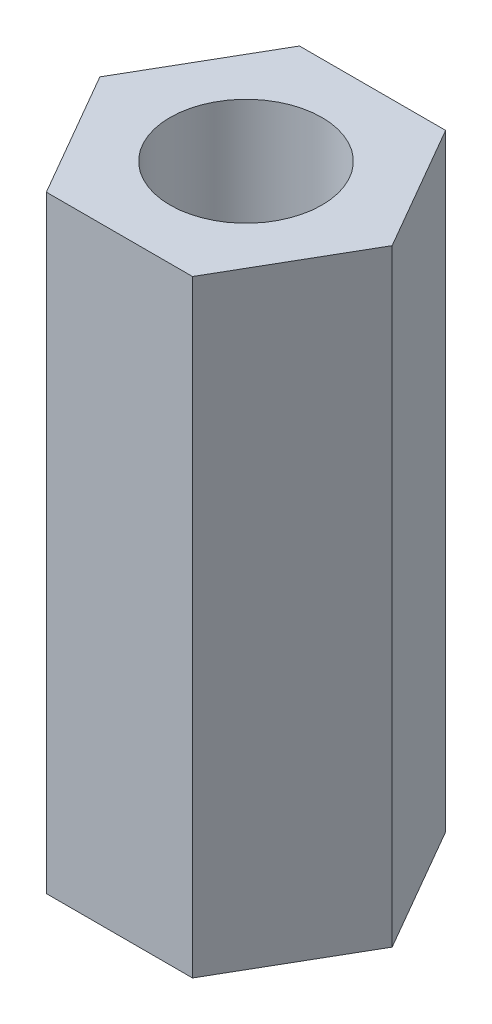
from build123d import *

# Parameters (mm, degrees)
CROQUIS1_R              = 1.5
SALIENTE_EXTRUIR1_DEPTH = 6


with BuildPart() as part:
    # Croquis1 → Saliente-Extruir1 (new, symmetric)
    with BuildSketch(Plane(origin=(0, 0, 0), x_dir=(1, 0, 0), z_dir=(0, 1, 0))):
        Polygon((1.443375673, -2.5), (2.886751346, 0), (1.443375673, 2.5), (-1.443375673, 2.5), (-2.886751346, 0), (-1.443375673, -2.5), align=None)
        Circle(CROQUIS1_R, mode=Mode.SUBTRACT)
    extrude(amount=SALIENTE_EXTRUIR1_DEPTH, both=True)


solid = part.part
